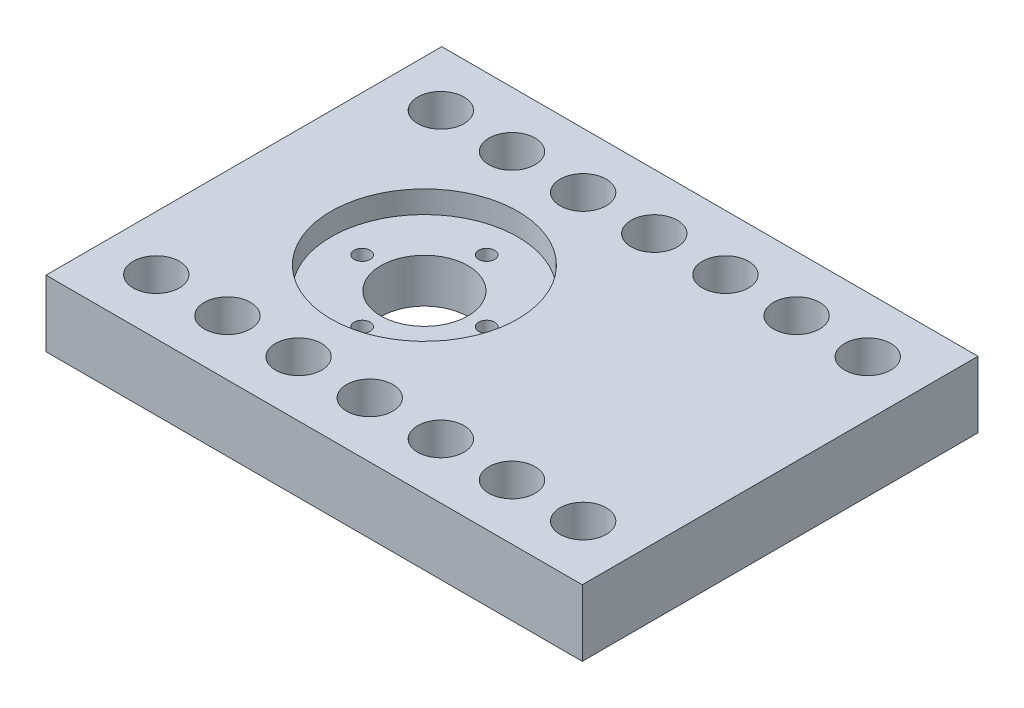
from build123d import *

# Parameters (mm, degrees)
SKETCH3_W           = 60.3
SKETCH3_H           = 44.5
SKETCH3_R           = 0.9
SKETCH3_R_2         = 4.9
BOSS_EXTRUDE1_DEPTH = 7.46
SKETCH4_R           = 10.5
CUT_EXTRUDE1_DEPTH  = 2.5
SKETCH5_R           = 2.6
CUT_EXTRUDE2_DEPTH  = 39.206499447


with BuildPart() as part:
    # Sketch3 → Boss-Extrude1 (new body)
    with BuildSketch(Plane(origin=(0, 0, 0), x_dir=(1, 0, 0), z_dir=(0, 1, 0))):
        Rectangle(SKETCH3_W, SKETCH3_H)
        with Locations((-9.85, 7)):
            Circle(SKETCH3_R, mode=Mode.SUBTRACT)
        with Locations((-16.85, 0)):
            Circle(SKETCH3_R, mode=Mode.SUBTRACT)
        with Locations((-9.85, -7)):
            Circle(SKETCH3_R, mode=Mode.SUBTRACT)
        with Locations((-2.85, 0)):
            Circle(SKETCH3_R, mode=Mode.SUBTRACT)
        with Locations((-9.85, 0)):
            Circle(SKETCH3_R_2, mode=Mode.SUBTRACT)
    extrude(amount=BOSS_EXTRUDE1_DEPTH)

    # Sketch4 → Cut-Extrude1 (cut)
    with BuildSketch(Plane(origin=(0, 7.46, 0), x_dir=(1, 0, 0), z_dir=(0, 1, 0))):
        with Locations((-9.85, 0)):
            Circle(SKETCH4_R)
    extrude(amount=-CUT_EXTRUDE1_DEPTH, mode=Mode.SUBTRACT)

    # Sketch5 → Cut-Extrude2 (cut, through all)
    with BuildSketch(Plane(origin=(0, 7.46, 0), x_dir=(1, 0, 0), z_dir=(0, 1, 0))):
        with Locations((0, 16)):
            Circle(SKETCH5_R)
        with Locations((8, 16)):
            Circle(SKETCH5_R)
        with Locations((16, 16)):
            Circle(SKETCH5_R)
        with Locations((24, 16)):
            Circle(SKETCH5_R)
        with Locations((-24, 16)):
            Circle(SKETCH5_R)
        with Locations((-16, 16)):
            Circle(SKETCH5_R)
        with Locations((-8, 16)):
            Circle(SKETCH5_R)
        with Locations((-8, -16)):
            Circle(SKETCH5_R)
        with Locations((-16, -16)):
            Circle(SKETCH5_R)
        with Locations((-24, -16)):
            Circle(SKETCH5_R)
        with Locations((24, -16)):
            Circle(SKETCH5_R)
        with Locations((16, -16)):
            Circle(SKETCH5_R)
        with Locations((8, -16)):
            Circle(SKETCH5_R)
        with Locations((0, -16)):
            Circle(SKETCH5_R)
    extrude(amount=-CUT_EXTRUDE2_DEPTH, mode=Mode.SUBTRACT)


solid = part.part
